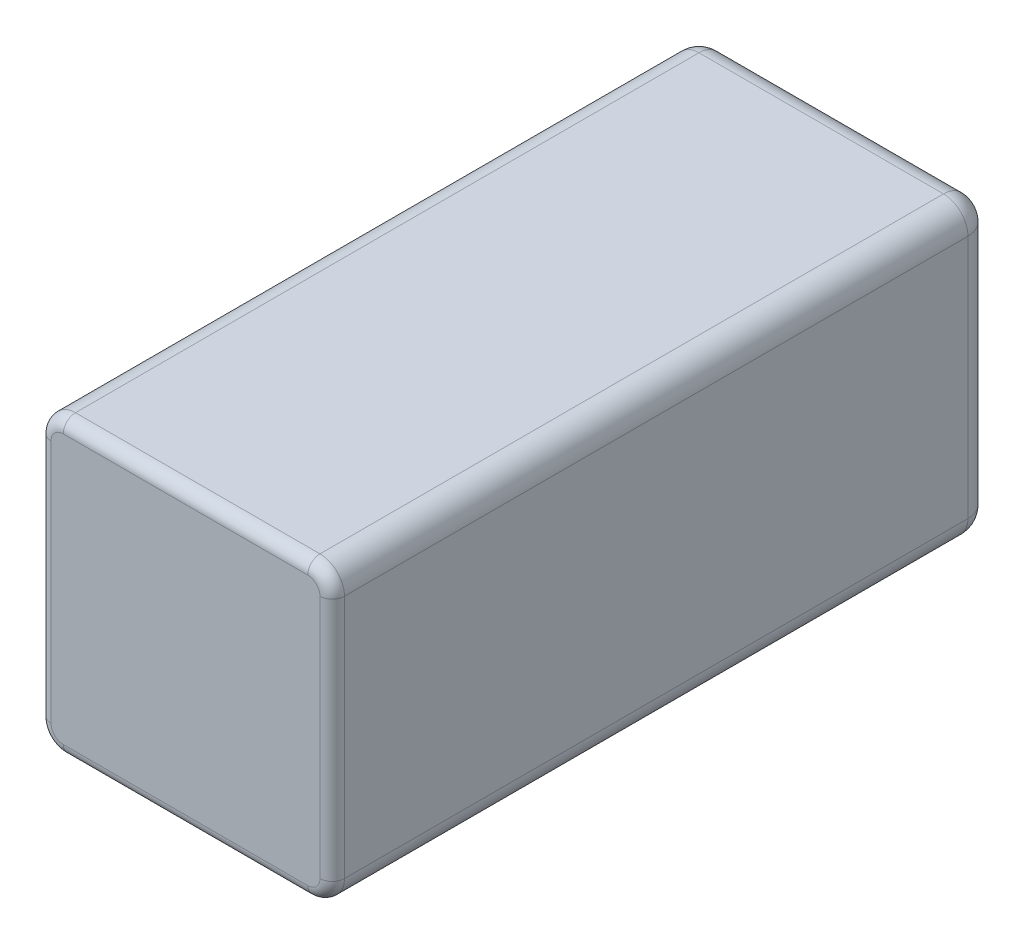
from build123d import *

# Parameters (mm, degrees)
BOSS_EXTRUDE1_DEPTH      = 220
BOSS_EXTRUDE1_DEPTH_BACK = 50
SKETCH1_W                = 120
SKETCH1_H                = 120
SKETCH3_W                = 40
SKETCH3_H                = 20
CUT_EXTRUDE2_DEPTH       = 10
RACCORDO1_R              = 10
RACCORDO2_R              = 10
RACCORDO3_R              = 5


with BuildPart() as part:
    # Sketch1 → Boss-Extrude1 (new, two sides: drawn at the far end of the back side and taken through both)
    with BuildSketch(Plane.XY.offset(-BOSS_EXTRUDE1_DEPTH_BACK)):
        Rectangle(SKETCH1_W, SKETCH1_H)
    extrude(amount=BOSS_EXTRUDE1_DEPTH + BOSS_EXTRUDE1_DEPTH_BACK)

    # Sketch3 → Cut-Extrude2 (cut)
    with BuildSketch(Plane.ZY.offset(60)):
        Rectangle(SKETCH3_W, SKETCH3_H)
    extrude(amount=-CUT_EXTRUDE2_DEPTH, mode=Mode.SUBTRACT)

    # Raccordo1
    raccordo1_edges = [part.edges().sort_by_distance(p)[0] for p in [
        (60, -60, 85),
        (-60, -60, 85),
        (60, 60, 85),
        (-60, 60, 85),
    ]]
    fillet(raccordo1_edges, radius=RACCORDO1_R)

    # Raccordo2
    raccordo2_edges = [part.edges().sort_by_distance(p)[0] for p in [
        (57.071067812, -57.071067812, -50),
        (-57.071067812, -57.071067812, -50),
        (57.071067812, 57.071067812, -50),
        (-57.071067812, 57.071067812, -50),
        (0, -60, -50),
        (60, 0, -50),
        (0, 60, -50),
        (-60, 0, -50),
    ]]
    fillet(raccordo2_edges, radius=RACCORDO2_R)

    # Raccordo3
    raccordo3_edges = [part.edges().sort_by_distance(p)[0] for p in [
        (57.071067812, -57.071067812, 220),
        (0, -60, 220),
        (-57.071067812, -57.071067812, 220),
        (-57.071067812, 57.071067812, 220),
        (57.071067812, 57.071067812, 220),
        (60, 0, 220),
        (0, 60, 220),
        (-60, 0, 220),
    ]]
    fillet(raccordo3_edges, radius=RACCORDO3_R)


solid = part.part
